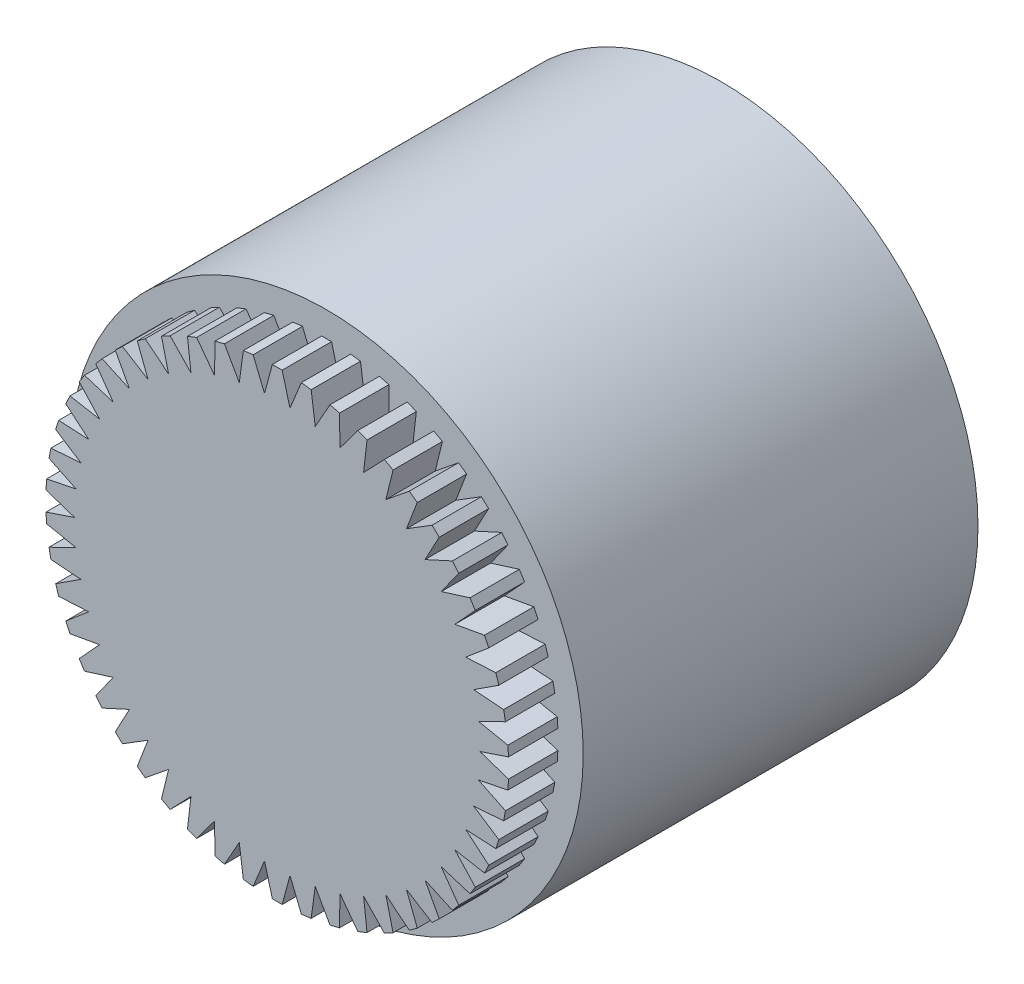
from build123d import *

# Parameters (mm, degrees)
SKETCH1_R           = 26
BOSS_EXTRUDE1_DEPTH = 40
SKETCH2_R           = 20
BOSS_EXTRUDE2_DEPTH = 5
BOSS_EXTRUDE3_DEPTH = 5
CIRPATTERN1_COUNT   = 50


with BuildPart() as part:
    # Sketch1 → Boss-Extrude1 (new body)
    with BuildSketch(Plane.XY):
        Circle(SKETCH1_R)
    extrude(amount=BOSS_EXTRUDE1_DEPTH)

    # Sketch2 → Boss-Extrude2 (add)
    with BuildSketch(Plane.XY.offset(40)):
        Circle(SKETCH2_R)
    extrude(amount=BOSS_EXTRUDE2_DEPTH)

    # Sketch3 → Boss-Extrude3 (add)
    with BuildSketch(Plane.XY.offset(45)):
        Polygon((0, 23.445373418), (-0.5, 23.445373418), (-1.79775122, 18.602099929), (1.79775122, 18.602099929), (0.5, 23.445373418), align=None)
    boss_extrude3 = extrude(amount=-BOSS_EXTRUDE3_DEPTH)

    # CirPattern1: Boss-Extrude3 ×50 about axis
    cirpattern1_axis = Axis((0, 0, 45), (0, 0, -1))
    for i in range(1, CIRPATTERN1_COUNT):
        add(boss_extrude3.rotate(cirpattern1_axis, i * 360 / CIRPATTERN1_COUNT))


solid = part.part
